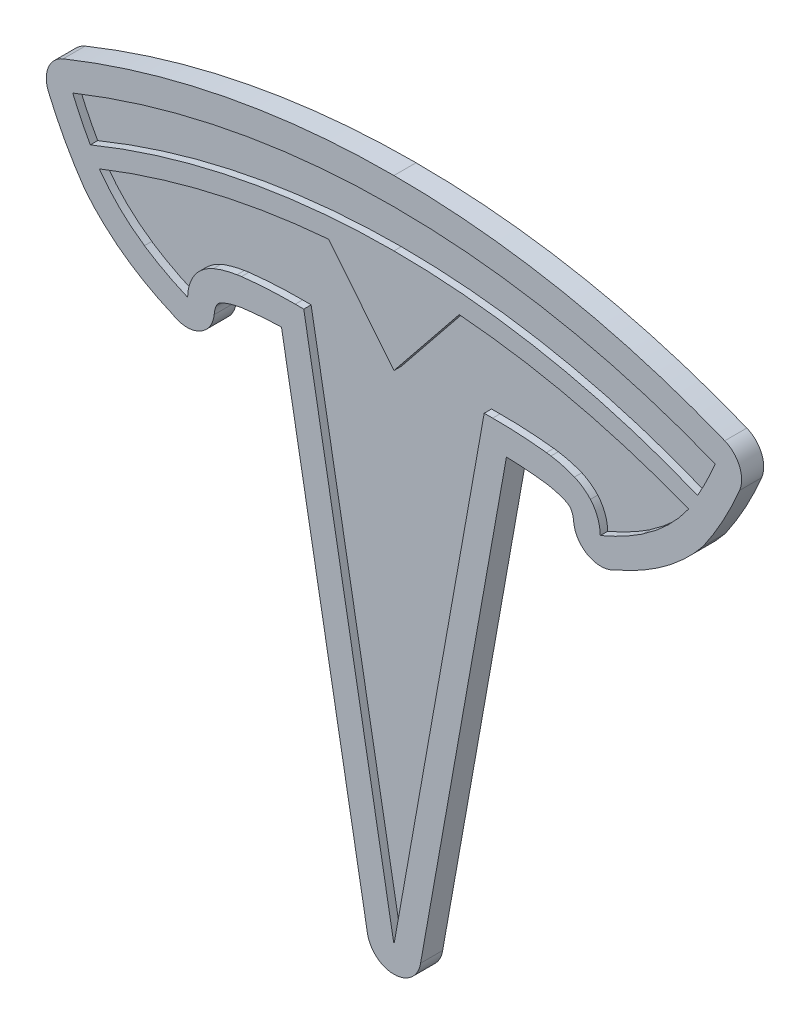
from build123d import *

# Parameters (mm, degrees)
EXTRUDE_1_DEPTH     = 3
CUT_EXTRUDE_START   = 2
CUT_EXTRUDE_2_DEPTH = 1


# Read off the part's stored shape, not the designer's step: 凸台-拉伸1
with BuildPart() as part:
    # 凸台-拉伸1 outline → 凸台-拉伸1 (new body)
    with BuildSketch(Plane.XY):
        with BuildLine():
            ThreePointArc((162.445637333, 148.797622459), (140.392019923, 155.335903316), (117.495676879, 157.542401146))
            Line((117.495676879, 157.542401146), (117.495472536, 134.594312545))
            Line((117.495472536, 134.594312545), (117.501791432, 134.597120738))
            Line((117.501791432, 134.597120738), (117.495472491, 134.589273862))
            Line((117.495472491, 134.589273862), (117.494839782, 63.535147265))
            ThreePointArc((117.494839782, 63.535147265), (119.8804724, 64.42052621), (121.110863339, 66.647918633))
            Line((121.110863339, 66.647918633), (132.779928848, 132.052204294))
            ThreePointArc((132.779928848, 132.052204294), (135.572070277, 131.909773522), (138.352611472, 131.618344369))
            Line((138.352611472, 131.618344369), (139.05961627, 131.462829611))
            ThreePointArc((139.05961627, 131.462829611), (140.089641052, 131.174253974), (141.080439341, 130.771084408))
            Line((141.080439341, 130.771084408), (141.349701494, 130.539383423))
            ThreePointArc((141.349701494, 130.539383423), (141.468445777, 130.418556757), (141.565445548, 130.279667116))
            Line((141.565445548, 130.279667116), (141.622802734, 130.169204712))
            Line((141.622802734, 130.169204712), (141.678161833, 130.040435885))
            ThreePointArc((141.678161833, 130.040435885), (141.844152912, 129.505116408), (141.925655993, 128.950610116))
            ThreePointArc((141.925655993, 128.950610116), (143.967564284, 125.988506969), (147.561018067, 126.163248026))
            ThreePointArc((147.561018067, 126.163248026), (151.438605128, 128.089662738), (155.033071354, 130.503491151))
            Line((155.033071354, 130.503491151), (155.399994914, 130.81714673))
            ThreePointArc((155.399994914, 130.81714673), (157.576828206, 132.755797519), (159.520841192, 134.927843461))
            ThreePointArc((159.520841192, 134.927843461), (162.226362027, 139.319204759), (164.46157289, 143.967616254))
            ThreePointArc((164.46157289, 143.967616254), (164.452492947, 146.79953259), (162.445637333, 148.797622459))
        make_face()
        with BuildLine():
            ThreePointArc((142.027144862, 134.324698861), (141.707350512, 134.449020168), (141.384659698, 134.56561713))
            ThreePointArc((141.384659698, 134.56561713), (141.70908775, 134.453653063), (142.027144862, 134.324698861))
        make_face(mode=Mode.SUBTRACT)
    extrude(amount=EXTRUDE_1_DEPTH)

    # 草图4<3> → 切除-拉伸2 (cut)
    with BuildSketch(Plane.XY.offset(CUT_EXTRUDE_START)):
        with BuildLine():
            Line((129.754075071, 135.691919441), (130.907867432, 135.696136475))
            ThreePointArc((130.907867432, 135.696136475), (134.565751216, 135.60175956), (138.211736169, 135.292220379))
            Line((138.211736169, 135.292220379), (138.826217651, 135.197784424))
            ThreePointArc((138.826217651, 135.197784424), (140.120063117, 134.940887305), (141.384659698, 134.56561713))
            ThreePointArc((141.384659698, 134.56561713), (142.906940981, 133.857183707), (144.196597811, 132.782007684))
            ThreePointArc((144.196597811, 132.782007684), (145.183330218, 131.10158314), (145.529755049, 129.183913374))
            ThreePointArc((145.529755049, 129.183913374), (148.547404982, 130.623014397), (151.425386163, 132.324321891))
            ThreePointArc((151.425386163, 132.324321891), (151.40801976, 132.330242443), (151.390651634, 132.336157937))
            ThreePointArc((151.390651634, 132.336157937), (154.736109947, 135.038022712), (157.532027719, 138.305285848))
            ThreePointArc((157.532027719, 138.305285848), (142.220764521, 143.112508129), (126.367587205, 145.606688512))
            Line((126.367587205, 145.606688512), (117.501791432, 134.597120738))
            Line((117.501791432, 134.597120738), (117.495472491, 134.589273862))
            Line((117.495472491, 134.589273862), (117.494872633, 67.224367653))
            Line((117.494872633, 67.224367653), (117.548172453, 67.340042661))
            Line((117.548172453, 67.340042661), (129.754075071, 135.691919441))
        make_face()
        with BuildLine():
            Line((117.495644097, 153.860880328), (117.495597882, 148.670868738))
            ThreePointArc((117.495597882, 148.670868738), (138.52210518, 146.608292632), (158.752427095, 140.517126524))
            ThreePointArc((158.752427095, 140.517126524), (160.02206081, 142.932720764), (161.14615728, 145.419379652))
            ThreePointArc((161.14615728, 145.419379652), (139.725666091, 151.733148545), (117.495644097, 153.860880328))
        make_face()
    extrude(amount=CUT_EXTRUDE_2_DEPTH, mode=Mode.SUBTRACT)

    # 镜向2: part across plane


with BuildPart() as part_1:
    add(part.part)
    add(part.part.mirror(Plane(origin=(117.494274017, -0.00104624, 3), x_dir=(0, 0, 1), z_dir=(0.999999999960354, -8.904603525034718e-06, 0))))


solid = part_1.part
